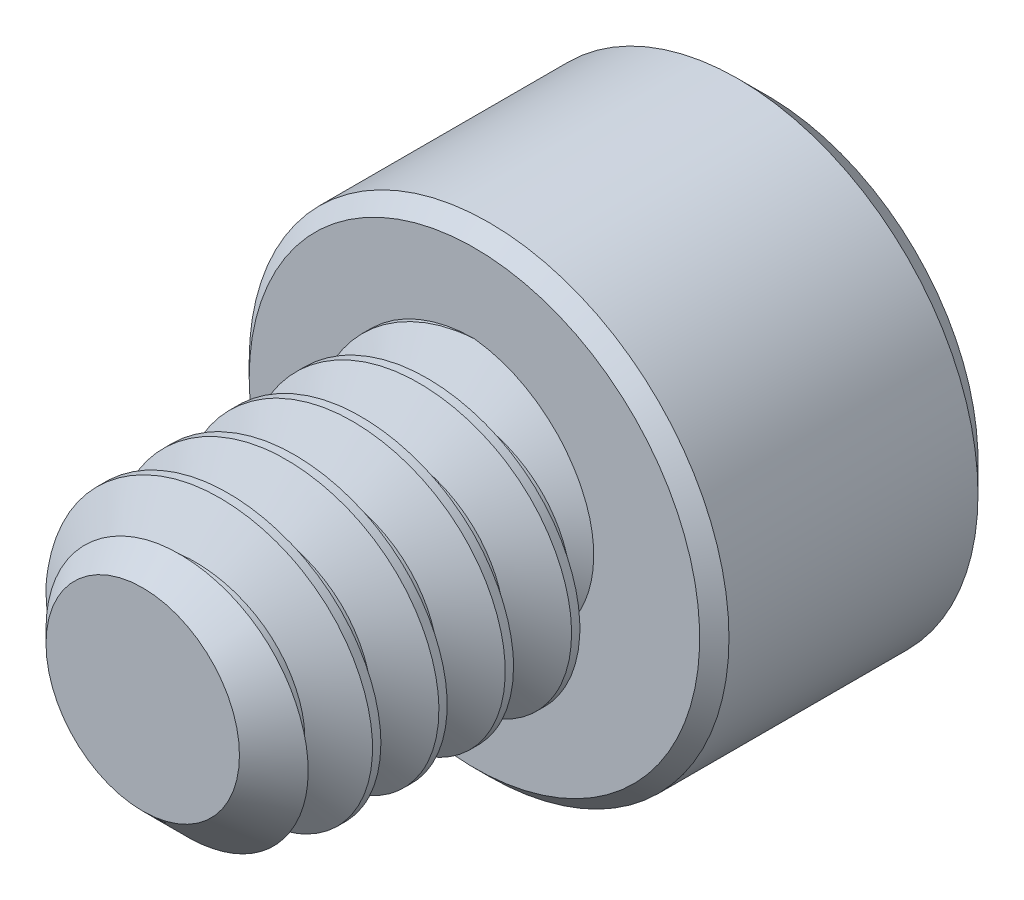
from build123d import *

# Parameters (mm, degrees)
SKETCH1_R          = 1.7526
EXTRUDE1_DEPTH     = 3.96875
CHAMFER3_SIZE      = 0.5953125
CUT_SWEEP1_PITCH   = 0.79375
SKETCH6_R          = 2.8702
EXTRUDE2_DEPTH     = 3.5052
CUT_EXTRUDE1_DEPTH = 2.08359375
SKETCH8_R          = 1.603951217
CUT_EXTRUDE2_DEPTH = 0.35052
CUT_EXTRUDE2_DRAFT = -45
CHAMFER1_SIZE      = 0.35052
CHAMFER2_SIZE      = 0.17526


with BuildPart() as part:
    # Sketch1 → Extrude1 (new body)
    with BuildSketch(Plane.XY):
        Circle(SKETCH1_R)
    extrude(amount=-EXTRUDE1_DEPTH)

    # Chamfer3
    chamfer3_edges = [part.edges().sort_by_distance(p)[0] for p in [
        (-1.7526, 0, 0),
    ]]
    chamfer(chamfer3_edges, length=CHAMFER3_SIZE)

    # Cut-Sweep1: the profile of Sketch3 profile screwed along a right-hand helix of 6 turns, 6 arcs to a turn; built about Z, then put on its axis
    cut_sweep1_z = Axis((0, 0, 0), (0, 0, 1))
    cut_sweep1_corners = [(1.7529, 0, -0.694704455), (1.237044252, 0, -0.396875), (1.237044252, 0, -0.29765625), (1.7529, 0, 0.000173205)]
    with BuildLine(mode=Mode.PRIVATE) as cut_sweep1_profile:
        Line(cut_sweep1_corners[0], cut_sweep1_corners[1])
        Line(cut_sweep1_corners[1], cut_sweep1_corners[2])
        Line(cut_sweep1_corners[2], cut_sweep1_corners[3])
        Line(cut_sweep1_corners[3], cut_sweep1_corners[0])
    cut_sweep1_cap = Face(cut_sweep1_profile.wire())
    cut_sweep1_turn_angles = [0, 30, 60, 90, 120, 150, 180, 210, 240, 270, 300, 330, 360]
    cut_sweep1_turn_weights = [1, 0.8660254037844387, 1, 0.8660254037844387, 1, 0.8660254037844387, 1, 0.8660254037844387, 1, 0.8660254037844387, 1, 0.8660254037844387, 1]
    cut_sweep1_turn_rails = [Edge.make_bspline([Vector(p[0], p[1], 0).rotate(cut_sweep1_z, cut_sweep1_turn_angles[k]) / cut_sweep1_turn_weights[k] + Vector(0, 0, p[2] + CUT_SWEEP1_PITCH * cut_sweep1_turn_angles[k] / 360) for k in range(13)], [0, 0, 0, 1, 1, 2, 2, 3, 3, 4, 4, 5, 5, 6, 6, 6], 2, cut_sweep1_turn_weights) for p in cut_sweep1_corners]
    cut_sweep1_turn_sides = [Face.make_surface_from_curves(cut_sweep1_turn_rails[p[0]], cut_sweep1_turn_rails[p[1]]) for p in [(0, 1), (1, 2), (2, 3), (3, 0)]]
    cut_sweep1 = Plane(origin=(0, 0, 0), x_dir=(0, 1, 0), z_dir=(0, 0, -1)) * Solid(Shell([*[p.moved(Location((0, 0, CUT_SWEEP1_PITCH * i))) for i in range(6) for p in cut_sweep1_turn_sides], cut_sweep1_cap, cut_sweep1_cap.rotate(cut_sweep1_z, 2160).moved(Location((0, 0, CUT_SWEEP1_PITCH * 2160 / 360)))]))
    add(cut_sweep1, mode=Mode.SUBTRACT)

    # Sketch6 → Extrude2 (add)
    with BuildSketch(Plane(origin=(0, 0, -3.96875), x_dir=(-1, 0, 0), z_dir=(0, 0, -1))):
        Circle(SKETCH6_R)
    extrude(amount=EXTRUDE2_DEPTH)

    # Sketch7 → Cut-Extrude1 (cut)
    with BuildSketch(Plane(origin=(0, 0, -7.47395), x_dir=(-1, 0, 0), z_dir=(0, 0, -1))):
        Polygon((0, 1.603951217), (-1.3890625, 0.801975608), (-1.3890625, -0.801975608), (0, -1.603951217), (1.3890625, -0.801975608), (1.3890625, 0.801975608), align=None)
    extrude(amount=-CUT_EXTRUDE1_DEPTH, mode=Mode.SUBTRACT)


with BuildPart() as cut_extrude2_tool:
    # Sketch8 → Cut-Extrude2 (with draft: the straight prism first)
    with BuildSketch(Plane(origin=(0, 0, -7.47395), x_dir=(-1, 0, 0), z_dir=(0, 0, -1))):
        Circle(SKETCH8_R)
    extrude(amount=-CUT_EXTRUDE2_DEPTH)
    # Cut-Extrude2: the draft: its side faces are tilted about the plane it starts from
    cut_extrude2_sides = [cut_extrude2_tool.faces().sort_by_distance(p)[0] for p in [
        (1.603951217, 0, -7.29869),
    ]]
    draft(cut_extrude2_sides, Plane(origin=(0, 0, -7.47395), x_dir=(-1, 0, 0), z_dir=(0, 0, -1)), CUT_EXTRUDE2_DRAFT)


with BuildPart() as part_1:
    add(part.part)

    # Cut-Extrude2: cut by cut_extrude2_tool
    add(cut_extrude2_tool.part, mode=Mode.SUBTRACT)

    # Chamfer1
    chamfer1_edges = [part_1.edges().sort_by_distance(p)[0] for p in [
        (2.8702, 0, -7.47395),
    ]]
    chamfer(chamfer1_edges, length=CHAMFER1_SIZE)

    # Chamfer2
    chamfer2_edges = [part_1.edges().sort_by_distance(p)[0] for p in [
        (2.8702, 0, -3.96875),
    ]]
    chamfer(chamfer2_edges, length=CHAMFER2_SIZE)


solid = part_1.part
